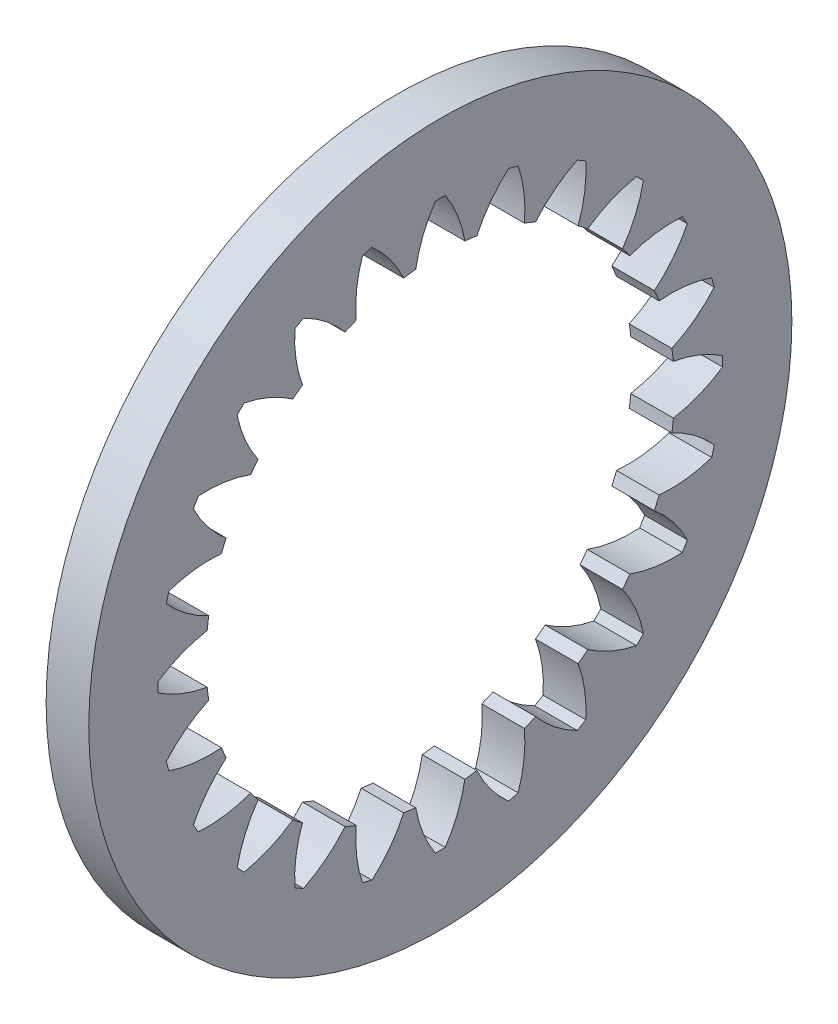
from build123d import *

# Parameters (mm, degrees)
BASPROSKE_W     = 2
BASPROSKE_H     = 5.5
TOOTHCUT_DEPTH  = 24.420076857
TEETHCUTS_COUNT = 24
TEETHCUTS_ANGLE = 345


with BuildPart() as part:
    # BasProSke → Base-Revolve (revolve)
    with BuildSketch(Plane(origin=(0, 0, 0), x_dir=(1, 0, 0), z_dir=(0, 1, 0))):
        with Locations((1, 13.75)):
            Rectangle(BASPROSKE_W, BASPROSKE_H)
    revolve(axis=Axis((-10, 0, 0), (1, 0, 0)))

    # TooCutSke → ToothCut (cut, through all)
    with BuildSketch(Plane(origin=(0, 0, 0), x_dir=(0, 0, -1), z_dir=(1, 0, 0))):
        with BuildLine():
            ThreePointArc((1.157347694, 10.913404211), (0.818153873, 12.13017782), (0.231735409, 13.248973534))
            ThreePointArc((0.231735409, 13.248973534), (0, 13.251), (-0.231735409, 13.248973534))
            ThreePointArc((-0.231735409, 13.248973534), (-0.818153873, 12.13017782), (-1.157347694, 10.913404211))
            ThreePointArc((-1.157347694, 10.913404211), (0, 10.9746), (1.157347694, 10.913404211))
        make_face()
    toothcut = extrude(amount=TOOTHCUT_DEPTH, mode=Mode.SUBTRACT)

    # TeethCuts: ToothCut ×24 about axis
    teethcuts_axis = Axis((-10, 0, 0), (1, 0, 0))
    for i in range(1, TEETHCUTS_COUNT):
        add(toothcut.rotate(teethcuts_axis, i * TEETHCUTS_ANGLE / (TEETHCUTS_COUNT - 1)), mode=Mode.SUBTRACT)


solid = part.part
